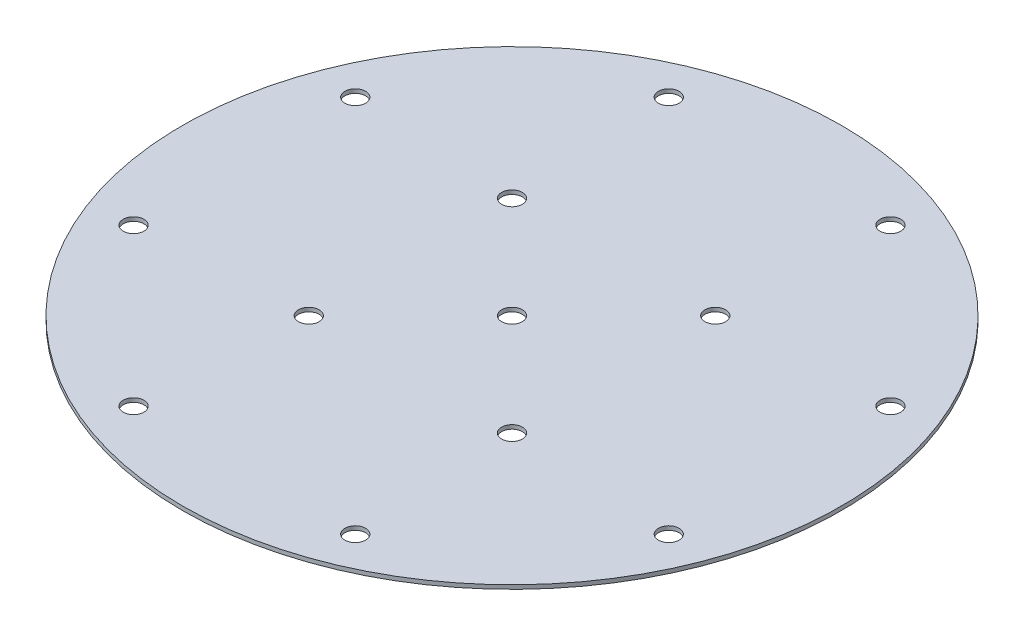
from build123d import *

# Parameters (mm, degrees)
SKETCH2_W                  = 82.55
SKETCH2_H                  = 1
F_6_0_204_DIAMETER_HOLE1_D = 5.1816
CIRPATTERN3_COUNT          = 4
F_6_0_204_DIAMETER_HOLE2_D = 5.1816


with BuildPart() as part:
    # Sketch2 → Revolve1 (revolve)
    with BuildSketch(Plane(origin=(0, 0, 0), x_dir=(0, 0, -1), z_dir=(1, 0, 0))):
        with Locations((-41.275, 0.5)):
            Rectangle(SKETCH2_W, SKETCH2_H)
    revolve(axis=Axis((0, -0.05, 0), (0, 1, 0)))

    # #6 (0.204) Diameter Hole1 (through all)
    with Locations(Plane(origin=(0, 1, 0), x_dir=(1, 0, 0), z_dir=(0, 1, 0))):
        with Locations((-27.763683018, 67.027460084), (264.743675233, 73.787758551), (-67.027460084, 27.763683018), (-25.455844123, 25.455844123)):
            f_6_0_204_diameter_hole1 = Hole(F_6_0_204_DIAMETER_HOLE1_D / 2)

    # CirPattern3: #6 (0.204) Diameter Hole1 ×4 about axis
    cirpattern3_axis = Axis((0, -0.05, 0), (0, 1, 0))
    for i in range(1, CIRPATTERN3_COUNT):
        add(f_6_0_204_diameter_hole1.rotate(cirpattern3_axis, i * 360 / CIRPATTERN3_COUNT), mode=Mode.SUBTRACT)

    # #6 (0.204) Diameter Hole2 (through all)
    with Locations(Plane(origin=(0, 1, 0), x_dir=(1, 0, 0), z_dir=(0, 1, 0))):
        with Locations((0, 0)):
            Hole(F_6_0_204_DIAMETER_HOLE2_D / 2)


solid = part.part
